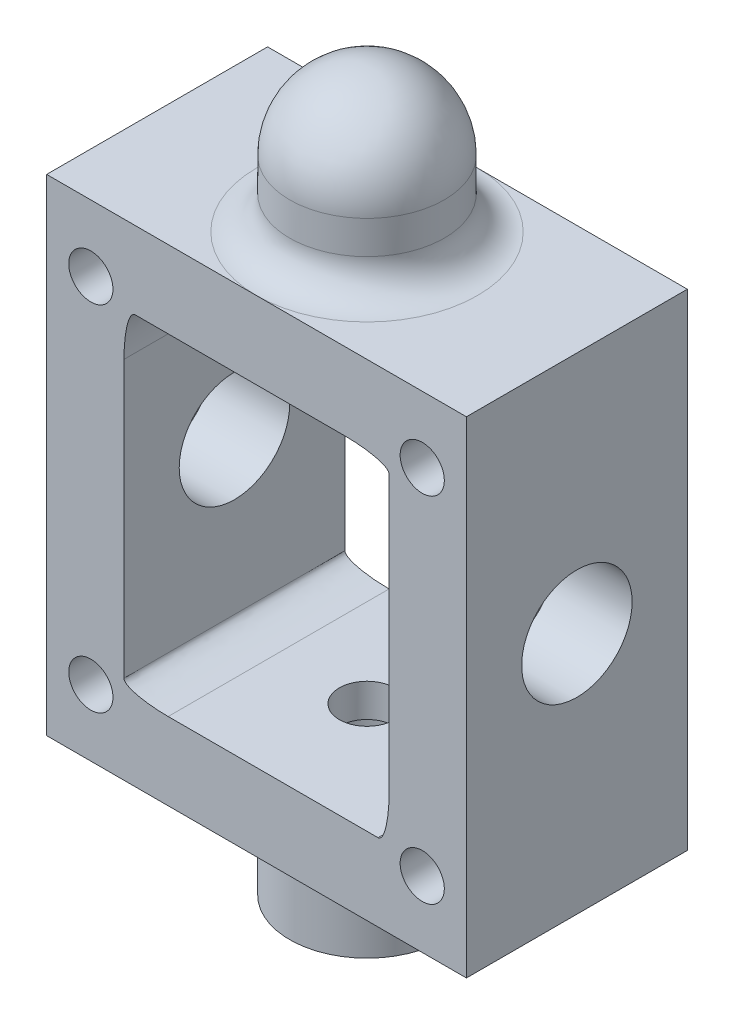
from build123d import *

# Parameters (mm, degrees)
SKETCH1_W               = 38
SKETCH1_H               = 44
SKETCH1_R               = 2
BOSS_EXTRUDE1_DEPTH     = 10
SKETCH2_R               = 7
BOSS_EXTRUDE2_DEPTH     = 13
FILLET1_R               = 3
FILLET2_R               = 7
CUT_EXTRUDE1_DEPTH      = 42.060930335
CUT_EXTRUDE1_DEPTH_BACK = 42.060930335
SKETCH3_W               = 24
SKETCH3_H               = 30
BOSS_EXTRUDE3_START     = 8
SKETCH4_R               = 7
BOSS_EXTRUDE3_DEPTH     = 8
CUT_EXTRUDE2_DEPTH      = 42.060930335
CUT_EXTRUDE2_DEPTH_BACK = 42.060930335
SKETCH8_R               = 5
CUT_EXTRUDE3_DEPTH      = 50.859803449
CUT_EXTRUDE3_DEPTH_BACK = 13
SKETCH9_R               = 1.75
FILLET3_SIZE            = 4
FILLET3_SIZE_2          = 1


# Some blends are built 0.0001 mm under size
with BuildPart() as part:
    # Sketch1 → Boss-Extrude1 (new, symmetric)
    with BuildSketch(Plane.XY):
        Rectangle(SKETCH1_W, SKETCH1_H)
        with Locations((-15, 16)):
            Circle(SKETCH1_R, mode=Mode.SUBTRACT)
        with Locations((15, 16)):
            Circle(SKETCH1_R, mode=Mode.SUBTRACT)
        with Locations((15, -16)):
            Circle(SKETCH1_R, mode=Mode.SUBTRACT)
        with Locations((-15, -16)):
            Circle(SKETCH1_R, mode=Mode.SUBTRACT)
    extrude(amount=BOSS_EXTRUDE1_DEPTH, both=True)

    # Sketch2 → Boss-Extrude2 (add)
    with BuildSketch(Plane(origin=(0, 22, 0), x_dir=(1, 0, 0), z_dir=(0, 1, 0))):
        with Locations(Location((0, 0, 0), (0, 0, 90))):
            Circle(SKETCH2_R)
    extrude(amount=BOSS_EXTRUDE2_DEPTH)

    # Fillet1
    fillet1_edges = [part.edges().sort_by_distance(p)[0] for p in [
        (0, 22, 7),
    ]]
    fillet(fillet1_edges, radius=FILLET1_R - 0.0001)  # a hair under: the kernel refuses the full size

    # Fillet2
    fillet2_edges = [part.edges().sort_by_distance(p)[0] for p in [
        (0, 35, 7),
    ]]
    fillet(fillet2_edges, radius=FILLET2_R)

    # Sketch3 → Cut-Extrude1 (cut, two sides: drawn at the far end of the back side and taken through both)
    with BuildSketch(Plane.XY.offset(-CUT_EXTRUDE1_DEPTH_BACK)):
        Rectangle(SKETCH3_W, SKETCH3_H)
    extrude(amount=CUT_EXTRUDE1_DEPTH + CUT_EXTRUDE1_DEPTH_BACK, mode=Mode.SUBTRACT)

    # Sketch4 → Boss-Extrude3 (add)
    with BuildSketch(Plane.XZ.offset(22).offset(BOSS_EXTRUDE3_START)):
        with Locations(Location((0, 0, 0), (0, 0, 270))):
            Circle(SKETCH4_R)
    extrude(amount=-BOSS_EXTRUDE3_DEPTH)

    # Sketch7 → Cut-Revolve1 (revolve, cut)
    with BuildSketch(Plane(origin=(0, 0, 0), x_dir=(0, 0, -1), z_dir=(1, 0, 0)), mode=Mode.PRIVATE) as cut_revolve1_sk:
        Polygon((0, -30), (0, -12.56), (2.5, -12.56), (2.5, -18), (5, -18), (5, -30), align=None)
    revolve(cut_revolve1_sk.sketch.rotate(Axis((0, -30, 0), (0, -1, 0)), 180), axis=Axis((0, -30, 0), (0, -1, 0)), mode=Mode.SUBTRACT)

    # Sketch8 → Cut-Extrude2 (cut, two sides: drawn at the far end of the back side and taken through both)
    with BuildSketch(Plane(origin=(0, 0, 0), x_dir=(0, 0, -1), z_dir=(1, 0, 0)).offset(-CUT_EXTRUDE2_DEPTH_BACK)):
        Circle(SKETCH8_R)
    extrude(amount=CUT_EXTRUDE2_DEPTH + CUT_EXTRUDE2_DEPTH_BACK, mode=Mode.SUBTRACT)

    # Sketch9 → Cut-Extrude3 (cut, two sides: drawn at the far end of the back side and taken through both)
    with BuildSketch(Plane.XZ.offset(-15).offset(-CUT_EXTRUDE3_DEPTH_BACK)):
        with Locations(Location((0, 0, 0), (0, 0, 90))):
            Circle(SKETCH9_R)
    extrude(amount=CUT_EXTRUDE3_DEPTH + CUT_EXTRUDE3_DEPTH_BACK, mode=Mode.SUBTRACT)

    # Fillet3
    # an asymmetric fillet: 4, 1 mm, written as the material it adds along each edge
    with BuildSketch(Plane(origin=(12, -15, -10), x_dir=(0, 1, 0), z_dir=(0, 0, 1))) as fillet3_piece_1:
        with BuildLine():
            Bezier((FILLET3_SIZE, 0), (0, 0), (0, FILLET3_SIZE_2), weights=[1, 0.707106781, 1])
            Line((0, FILLET3_SIZE_2), (0, 0))
            Line((0, 0), (FILLET3_SIZE, 0))
        make_face()
    extrude(amount=20)
    with BuildSketch(Plane(origin=(12, 15, -10), x_dir=(0, -1, 0), z_dir=(0, 0, 1))) as fillet3_piece_2:
        with BuildLine():
            Bezier((FILLET3_SIZE_2, 0), (0, 0), (0, -FILLET3_SIZE), weights=[1, 0.707106781, 1])
            Line((0, -FILLET3_SIZE), (0, 0))
            Line((0, 0), (FILLET3_SIZE_2, 0))
        make_face()
    extrude(amount=20)
    with BuildSketch(Plane(origin=(-12, -15, 10), x_dir=(0, 1, 0), z_dir=(0, 0, -1)), Plane(origin=(-12, 15, 10), x_dir=(1, 0, 0), z_dir=(0, 0, -1))) as fillet3_piece_3:
        with BuildLine():
            Bezier((FILLET3_SIZE_2, 0), (0, 0), (0, FILLET3_SIZE), weights=[1, 0.707106781, 1])
            Line((0, FILLET3_SIZE), (0, 0))
            Line((0, 0), (FILLET3_SIZE_2, 0))
        make_face()
    extrude(amount=20)


solid = part.part
